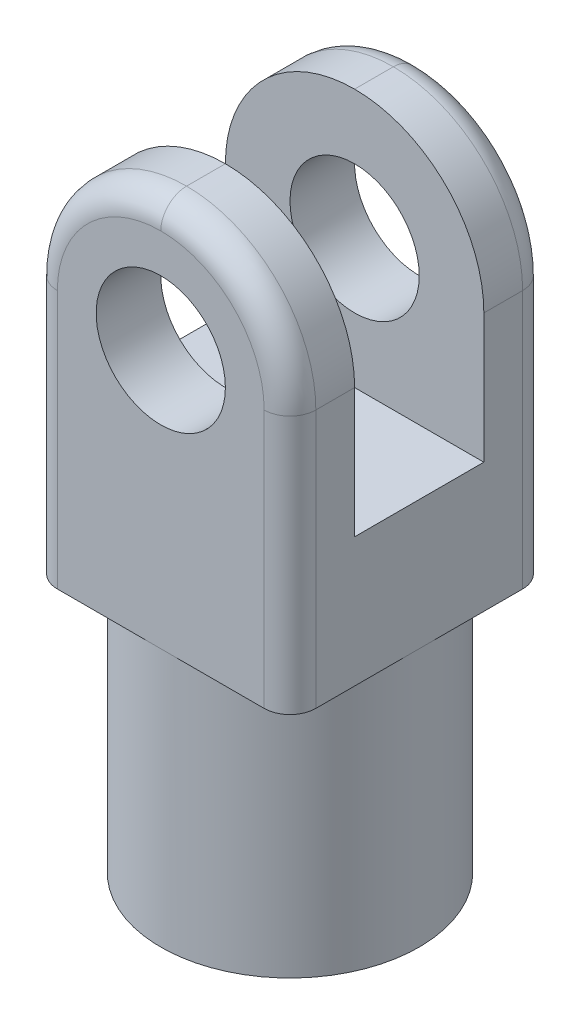
from build123d import *

# Parameters (mm, degrees)
SKETCH1_W           = 100
SKETCH1_H           = 100
BOSS_EXTRUDE1_DEPTH = 150
SKETCH2_R           = 50
SKETCH2_R_2         = 25
BOSS_EXTRUDE2_DEPTH = 100
SKETCH3_W           = 100
SKETCH3_H           = 50
CUT_EXTRUDE1_DEPTH  = 100
SKETCH4_R           = 25
CUT_EXTRUDE2_DEPTH  = 188.082869339
FILLET1_R           = 50
FILLET2_R           = 10


with BuildPart() as part:
    # Sketch1 → Boss-Extrude1 (new body)
    with BuildSketch(Plane(origin=(0, 0, 0), x_dir=(1, 0, 0), z_dir=(0, 1, 0))):
        Rectangle(SKETCH1_W, SKETCH1_H)
    extrude(amount=BOSS_EXTRUDE1_DEPTH)

    # Sketch2 → Boss-Extrude2 (add)
    with BuildSketch(Plane.XZ):
        with Locations(Location((0, 0, 0), (0, 0, 270))):
            Circle(SKETCH2_R)
        with Locations(Location((0, 0, 0), (0, 0, 270))):
            Circle(SKETCH2_R_2, mode=Mode.SUBTRACT)
    extrude(amount=BOSS_EXTRUDE2_DEPTH)

    # Sketch3 → Cut-Extrude1 (cut)
    with BuildSketch(Plane(origin=(0, 150, 0), x_dir=(1, 0, 0), z_dir=(0, 1, 0))):
        Rectangle(SKETCH3_W, SKETCH3_H)
    extrude(amount=-CUT_EXTRUDE1_DEPTH, mode=Mode.SUBTRACT)

    # Sketch4 → Cut-Extrude2 (cut, through all)
    with BuildSketch(Plane.XY.offset(50)):
        with Locations((0, 100)):
            Circle(SKETCH4_R)
    extrude(amount=-CUT_EXTRUDE2_DEPTH, mode=Mode.SUBTRACT)

    # Fillet1
    fillet1_edges = [part.edges().sort_by_distance(p)[0] for p in [
        (50, 150, 37.5),
        (50, 150, -37.5),
        (-50, 150, -37.5),
        (-50, 150, 37.5),
    ]]
    fillet(fillet1_edges, radius=FILLET1_R - 0.0001)  # a hair under: the kernel refuses the full size

    # Fillet2
    fillet2_edges = [part.edges().sort_by_distance(p)[0] for p in [
        (50, 50.00005, 50),
        (50, 50.00005, -50),
        (-50, 50.00005, 50),
        (-35.355368349, 135.355368349, 50),
        (35.355368349, 135.355368349, 50),
        (-50, 50.00005, -50),
        (-35.355368349, 135.355368349, -50),
        (35.355368349, 135.355368349, -50),
    ]]
    fillet(fillet2_edges, radius=FILLET2_R)


solid = part.part
